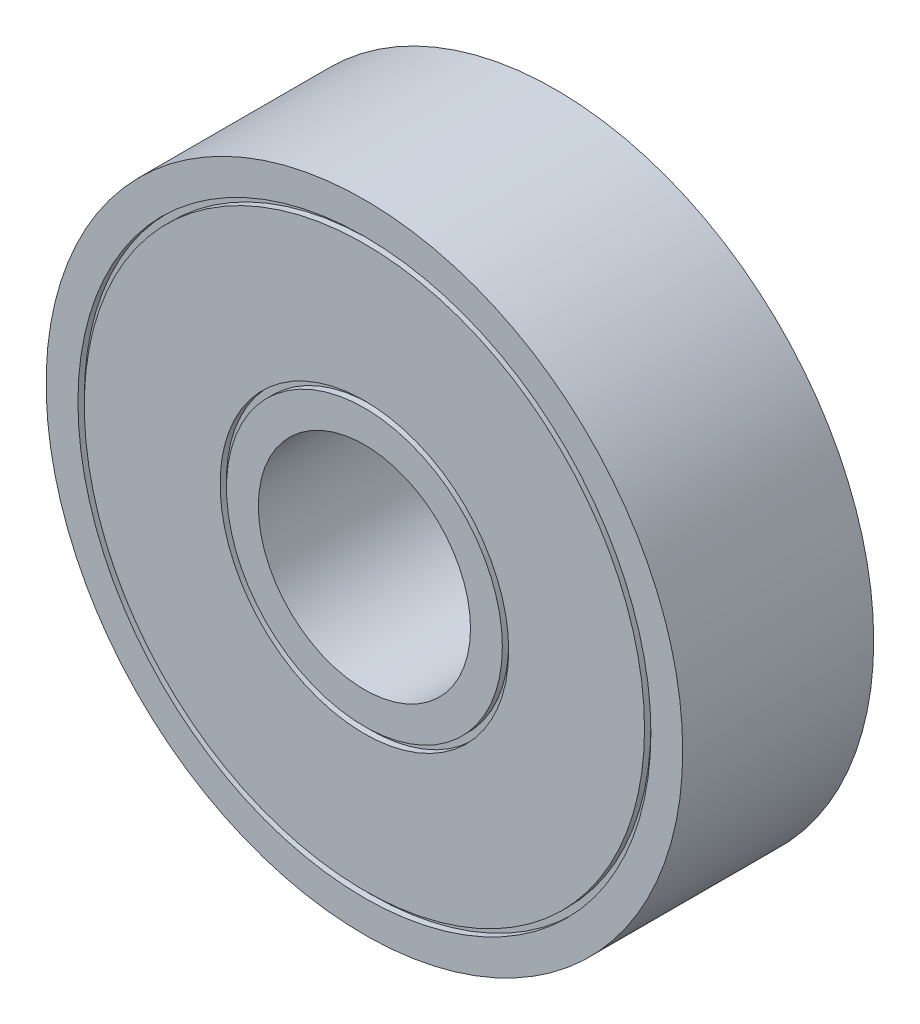
from build123d import *

# Parameters (mm, degrees)
CROQUIS1_R              = 15
CROQUIS1_R_2            = 5
SALIENTE_EXTRUIR1_DEPTH = 9
CROQUIS2_R              = 13.5
CROQUIS2_R_2            = 13.2
CROQUIS2_R_3            = 6.8
CROQUIS2_R_4            = 6.5
CORTAR_EXTRUIR1_DEPTH   = 0.3


with BuildPart() as part:
    # Croquis1 → Saliente-Extruir1 (new body)
    with BuildSketch(Plane.XY):
        Circle(CROQUIS1_R)
        Circle(CROQUIS1_R_2, mode=Mode.SUBTRACT)
    extrude(amount=SALIENTE_EXTRUIR1_DEPTH)

    # Croquis2 → Cortar-Extruir1 (cut)
    # profile 1 of 2: a face of its own
    with BuildSketch(Plane.XY.offset(9)):
        Circle(CROQUIS2_R)
        Circle(CROQUIS2_R_2, mode=Mode.SUBTRACT)
    # profile 2 of 2: a face of its own
    with BuildSketch(Plane.XY.offset(9)):
        Circle(CROQUIS2_R_3)
        Circle(CROQUIS2_R_4, mode=Mode.SUBTRACT)
    cortar_extruir1 = extrude(amount=-CORTAR_EXTRUIR1_DEPTH, mode=Mode.SUBTRACT)

    # Simetría1: Cortar-Extruir1 across plane
    add(cortar_extruir1.mirror(Plane.XY.offset(4.5)), mode=Mode.SUBTRACT)


solid = part.part
